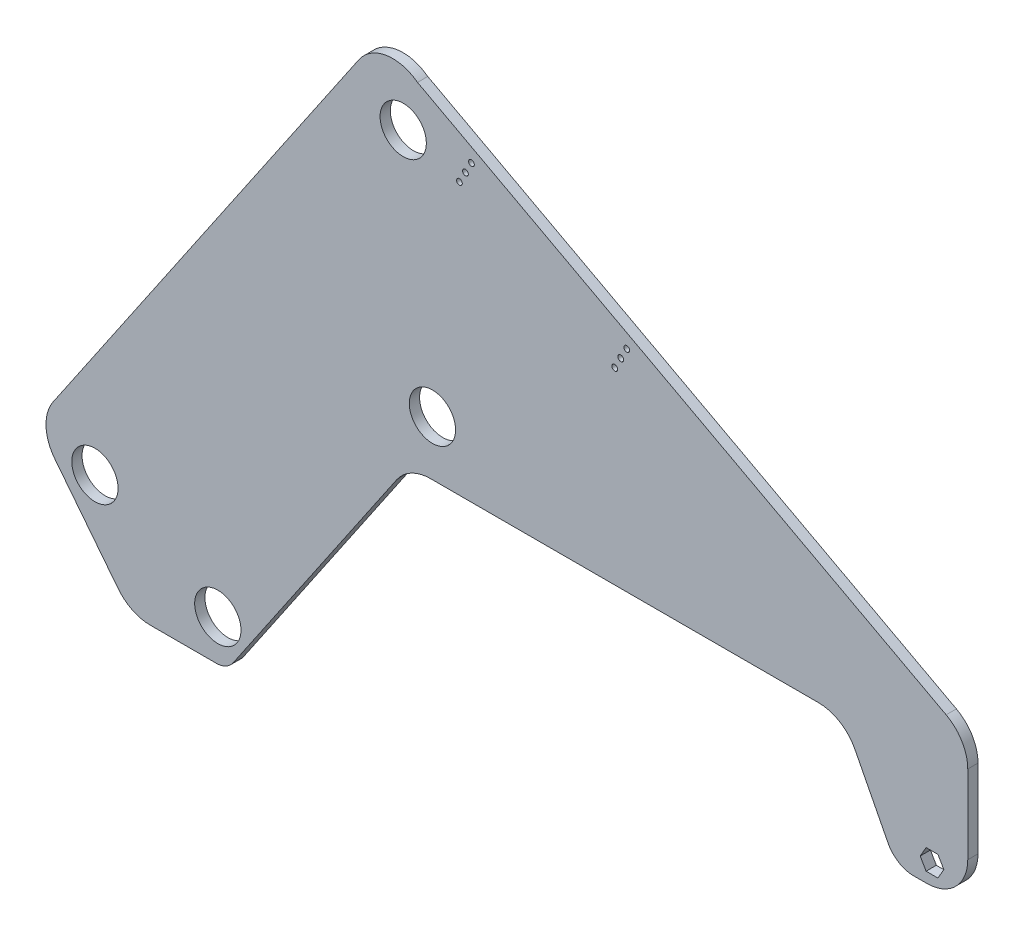
from build123d import *

# Parameters (mm, degrees)
MODEL_R             = 14.351
MODEL_R_2           = 1.778
BOSS_EXTRUDE1_DEPTH = 6.35


with BuildPart() as part:
    # Model → Boss-Extrude1 (new body)
    with BuildSketch(Plane.XY):
        with BuildLine():
            ThreePointArc((-212.899365952, 93.541257838), (-203.778989185, 101.701881024), (-191.901103209, 104.650248016))
            Line((-191.901103209, 104.650248016), (48.661197018, 104.650248016))
            ThreePointArc((48.661197018, 104.650248016), (61.901986038, 100.926075708), (71.260020742, 90.8456422))
            Line((71.260020742, 90.8456422), (91.800416921, 50.813472087))
            ThreePointArc((91.800416921, 50.813472087), (98.351041214, 43.757168632), (107.619593528, 41.150248016))
            Line((107.619593528, 41.150248016), (115.808590566, 41.150248016))
            ThreePointArc((115.808590566, 41.150248016), (133.769102808, 48.589735774), (141.208590566, 66.550248016))
            Line((141.208590566, 66.550248016), (141.208590566, 115.30333804))
            ThreePointArc((141.208590566, 115.30333804), (137.602779127, 128.348388632), (127.809114585, 137.689660276))
            Line((127.809114585, 137.689660276), (-199.949582693, 313.389629113))
            ThreePointArc((-199.949582693, 313.389629113), (-219.402189514, 318.224062751), (-236.303247901, 307.447705012))
            Line((-236.303247901, 307.447705012), (-425.920878295, 28.83612519))
            ThreePointArc((-425.920878295, 28.83612519), (-430.307847502, 13.679090678), (-424.898106806, -1.143726181))
            Line((-424.898106806, -1.143726181), (-385.58146606, -51.20282143))
            ThreePointArc((-385.58146606, -51.20282143), (-376.71145599, -58.357541068), (-365.605974805, -60.913979882))
            Line((-365.605974805, -60.913979882), (-324.737451002, -60.913979882))
            ThreePointArc((-324.737451002, -60.913979882), (-318.798508014, -59.439796386), (-314.23831963, -55.359484793))
            Line((-314.23831963, -55.359484793), (-212.899365952, 93.541257838))
        make_face()
        with Locations((-323.775189267, -35.513979882)):
            Circle(MODEL_R, mode=Mode.SUBTRACT)
        with Locations((-399.975189267, 2.586020118)):
            Circle(MODEL_R, mode=Mode.SUBTRACT)
        Polygon((122.716975548, 60.200248016), (126.383149757, 53.850248016), (122.716975548, 47.500248016), (115.384627129, 47.500248016), (111.71845292, 53.850248016), (115.384627129, 60.200248016), align=None, mode=Mode.SUBTRACT)
        with Locations((-190.707148919, 138.516914683)):
            Circle(MODEL_R, mode=Mode.SUBTRACT)
        with Locations((-77.666969975, 221.324366702)):
            Circle(MODEL_R_2, mode=Mode.SUBTRACT)
        with Locations((-73.946807529, 228.264126595)):
            Circle(MODEL_R_2, mode=Mode.SUBTRACT)
        with Locations((-70.226645083, 235.203886488)):
            Circle(MODEL_R_2, mode=Mode.SUBTRACT)
        with Locations((-208.832932893, 283.437784316)):
            Circle(MODEL_R, mode=Mode.SUBTRACT)
        with Locations((-173.961165941, 272.94431568)):
            Circle(MODEL_R_2, mode=Mode.SUBTRACT)
        with Locations((-170.241003495, 279.884075573)):
            Circle(MODEL_R_2, mode=Mode.SUBTRACT)
        with Locations((-166.520841049, 286.823835466)):
            Circle(MODEL_R_2, mode=Mode.SUBTRACT)
    extrude(amount=BOSS_EXTRUDE1_DEPTH)


solid = part.part
